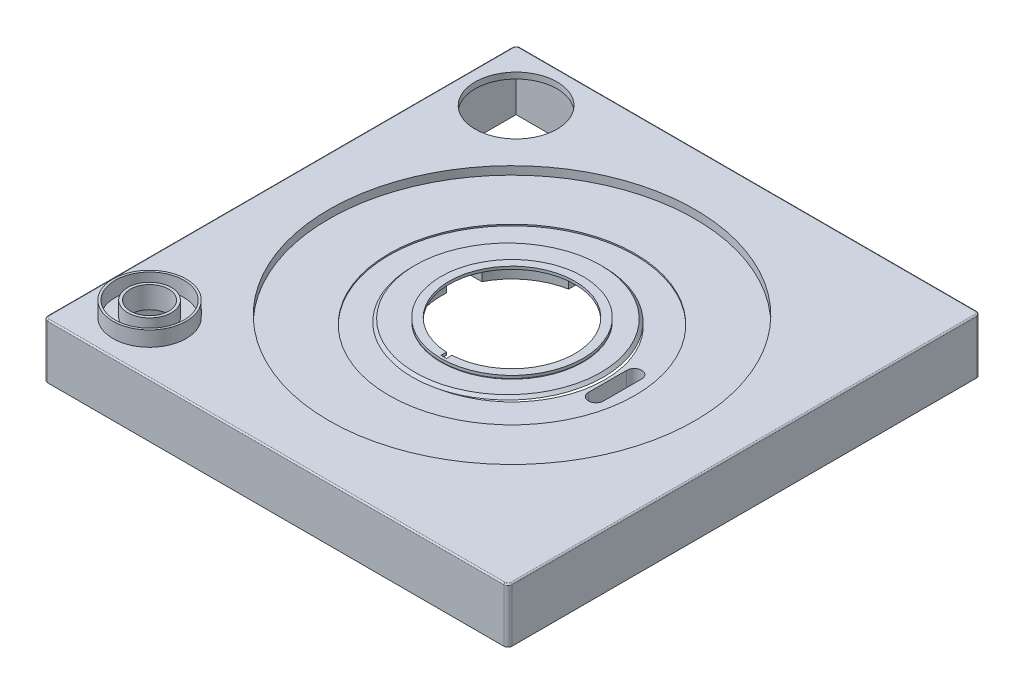
from build123d import *
from build123d.topology import SkipClean

# Parameters (mm, degrees)
EXTRUDE_1_DEPTH          = 20
SKETCH_4_R               = 67
CUT_EXTRUDE_2_DEPTH      = 3
SHELL_9_T                = -2.2
SKETCH_9_R               = 45
CUT_EXTRUDE_3_DEPTH      = 0.5
SKETCH_11_R              = 26
SKETCH_11_R_2            = 23
EXTRUDE_2_DEPTH          = 1.2
SKETCH_14_R              = 23
CUT_EXTRUDE_4_DEPTH      = 5
SKETCH_15_R              = 34
CUT_EXTRUDE_5_DEPTH      = 2
SKETCH_16_R              = 26
CUT_EXTRUDE_9_DEPTH      = 1.2
EXTRUDE_4_DEPTH          = 4
CUT_EXTRUDE_10_DEPTH     = 3
CUT_EXTRUDE_START        = 17.8
CUT_EXTRUDE_11_OUTLINE_R = 15
CUT_EXTRUDE_11_DEPTH     = 2.2
SKETCH_25_R              = 17.002315459
SKETCH_25_R_2            = 15.503974497
CUT_EXTRUDE_12_DEPTH     = 0.5
SKETCH_26_R              = 13.4
SKETCH_26_R_2            = 12.6
EXTRUDE_5_DEPTH          = 5.5
EXTRUDE_6_DEPTH          = 5.5
EXTRUDE_6_DEPTH_BACK     = 2.5
SKETCH_27_R              = 8
SKETCH_27_R_2            = 7
SKETCH_28_R              = 7
CUT_EXTRUDE_13_DEPTH     = 3
FILLET_1_R               = 0.5
CUT_EXTRUDE_14_DEPTH     = 3
EXTRUDE_7_DEPTH          = 16.8


# Read off the part's stored shape, not the designer's step: 切除-拉伸11
with BuildPart() as part:
    # 草图2 → 凸台-拉伸1 (new body)
    with BuildSketch(Plane(origin=(0, 0, 0), x_dir=(1, 0, 0), z_dir=(0, 1, 0))):
        with BuildLine():
            Line((-83.5, 86.5), (83.5, 86.5))
            ThreePointArc((83.5, 86.5), (84.560660172, 86.060660172), (85, 85))
            Line((85, 85), (85, -85))
            ThreePointArc((85, -85), (84.560660172, -86.060660172), (83.5, -86.5))
            Line((83.5, -86.5), (-83.5, -86.5))
            ThreePointArc((-83.5, -86.5), (-84.560660172, -86.060660172), (-85, -85))
            Line((-85, -85), (-85, 85))
            ThreePointArc((-85, 85), (-84.560660172, 86.060660172), (-83.5, 86.5))
        make_face()
    extrude(amount=EXTRUDE_1_DEPTH)

    # 草图4 → 切除-拉伸2 (cut)
    with BuildSketch(Plane(origin=(0, 20, 0), x_dir=(1, 0, 0), z_dir=(0, 1, 0))):
        with Locations(Location((0, 0, 0), (0, 0, 270))):
            Circle(SKETCH_4_R)
    extrude(amount=-CUT_EXTRUDE_2_DEPTH, mode=Mode.SUBTRACT)

    # 抽壳9
    shell_9_openings = [part.faces().sort_by_distance(p)[0] for p in [
        (0, 0, 0),
    ]]
    offset(amount=SHELL_9_T, openings=shell_9_openings, kind=Kind.INTERSECTION)

    # 草图9 → 切除-拉伸3 (cut)
    with BuildSketch(Plane(origin=(0, 17, 0), x_dir=(1, 0, 0), z_dir=(0, 1, 0))):
        with Locations(Location((0, 0, 0), (0, 0, 270))):
            Circle(SKETCH_9_R)
    extrude(amount=-CUT_EXTRUDE_3_DEPTH, mode=Mode.SUBTRACT)


with BuildPart() as body_2:
    # 草图10 → 旋转1 (revolve)
    with BuildSketch(Plane.XY, mode=Mode.PRIVATE) as revolve_1_sk:
        Polygon((-1.499800563, 17.05484119), (-36.499800563, 17.05484119), (-35.499800563, 18.05484119), (-1.499800563, 18.05484119), align=None)
    revolve(revolve_1_sk.sketch.rotate(Axis((-1.499800563, 17.05484119, 0), (0, 1, 0)), 270), axis=Axis((-1.499800563, 17.05484119, 0), (0, 1, 0)))

    # 草图11 → 凸台-拉伸2 (add)
    with BuildSketch(Plane(origin=(0, 18.05484119, 0), x_dir=(1, 0, 0), z_dir=(0, 1, 0))):
        with Locations(Location((0, 0, 0), (0, 0, 90))):
            Circle(SKETCH_11_R)
        with Locations(Location((0, 0, 0), (0, 0, 270))):
            Circle(SKETCH_11_R_2, mode=Mode.SUBTRACT)
    extrude(amount=EXTRUDE_2_DEPTH)


with BuildPart() as cut_extrude_4_tool:
    # 草图14 → 切除-拉伸4 (new body)
    with BuildSketch(Plane(origin=(0, 18.05484119, 0), x_dir=(1, 0, 0), z_dir=(0, 1, 0))):
        with Locations(Location((0, 0, 0), (0, 0, 270))):
            Circle(SKETCH_14_R)
    extrude(amount=-CUT_EXTRUDE_4_DEPTH)


with BuildPart() as part_1:
    add(part.part)

    # 切除-拉伸4: cut by cut_extrude_4_tool
    add(cut_extrude_4_tool.part, mode=Mode.SUBTRACT)

    # 草图15 → 切除-拉伸5 (cut)
    with BuildSketch(Plane.XZ.offset(-14.8)):
        with Locations(Location((0, 0, 0), (0, 0, 270))):
            Circle(SKETCH_15_R)
    extrude(amount=-CUT_EXTRUDE_5_DEPTH, mode=Mode.SUBTRACT)

    # 切除-拉伸11 outline → 切除-拉伸11 (cut)
    with BuildSketch(Plane(origin=(0, 0, 0), x_dir=(1, 0, 0), z_dir=(0, 1, 0)).offset(CUT_EXTRUDE_START)):
        with Locations((-65.7, 67.2)):
            Circle(CUT_EXTRUDE_11_OUTLINE_R)
    extrude(amount=CUT_EXTRUDE_11_DEPTH, mode=Mode.SUBTRACT)

    # 草图25 → 切除-拉伸12 (cut)
    with BuildSketch(Plane.XZ.offset(-17.8)):
        with Locations(Location((-65.7438908, -67.2, 0), (0, 0, 270))):
            Circle(SKETCH_25_R)
        with Locations(Location((-65.7438908, -67.2, 0), (0, 0, 270))):
            Circle(SKETCH_25_R_2, mode=Mode.SUBTRACT)
    extrude(amount=-CUT_EXTRUDE_12_DEPTH, mode=Mode.SUBTRACT)

    # 草图26 → 凸台-拉伸5 (add)
    with BuildSketch(Plane(origin=(0, 20, 0), x_dir=(1, 0, 0), z_dir=(0, 1, 0))):
        with Locations(Location((-65.6, -67.1, 0), (0, 0, 90))):
            Circle(SKETCH_26_R)
        with Locations(Location((-65.6, -67.1, 0), (0, 0, 270))):
            Circle(SKETCH_26_R_2, mode=Mode.SUBTRACT)
    extrude(amount=EXTRUDE_5_DEPTH)

    # 草图27 → 凸台-拉伸6 (add, two sides: drawn at the far end of the back side and taken through both)
    with BuildSketch(Plane(origin=(0, 20, 0), x_dir=(1, 0, 0), z_dir=(0, 1, 0)).offset(-EXTRUDE_6_DEPTH_BACK)):
        with Locations(Location((-65.6, -67.1, 0), (0, 0, 90))):
            Circle(SKETCH_27_R)
        with Locations(Location((-65.6, -67.1, 0), (0, 0, 90))):
            Circle(SKETCH_27_R_2, mode=Mode.SUBTRACT)
    extrude(amount=EXTRUDE_6_DEPTH + EXTRUDE_6_DEPTH_BACK)

    # 草图28 → 切除-拉伸13 (cut)
    with SkipClean():  # the faces are left unmerged after this step: merging them gives an invalid solid
        with BuildSketch(Plane(origin=(0, 20, 0), x_dir=(1, 0, 0), z_dir=(0, 1, 0))):
            with Locations(Location((-65.6, -67.1, 0), (0, 0, 270))):
                Circle(SKETCH_28_R)
        extrude(amount=-CUT_EXTRUDE_13_DEPTH, mode=Mode.SUBTRACT)
    add(part_1.part.scale(1), mode=Mode.REPLACE)  # the faces are merged on a copy

    # 圆角1
    fillet_1_edges = [part_1.edges().sort_by_distance(p)[0] for p in [
        (84.560660172, 20, 86.060660172),
        (85, 20, 0),
        (84.560660172, 20, -86.060660172),
        (0, 20, -86.5),
        (-84.560660172, 20, -86.060660172),
        (-85, 20, 0),
        (-84.560660172, 20, 86.060660172),
        (0, 20, 86.5),
    ]]
    fillet(fillet_1_edges, radius=FILLET_1_R)

    # 草图30 → 切除-拉伸14 (cut)
    with BuildSketch(Plane(origin=(0, 16.5, 0), x_dir=(1, 0, 0), z_dir=(0, 1, 0))):
        with BuildLine():
            Line((35, -7), (35, 7))
            ThreePointArc((35, 7), (37.75, 9.75), (40.5, 7))
            Line((40.5, 7), (40.5, -7))
            ThreePointArc((40.5, -7), (37.75, -9.75), (35, -7))
        make_face()
    extrude(amount=-CUT_EXTRUDE_14_DEPTH, mode=Mode.SUBTRACT)

    # 草图31 → 凸台-拉伸7 (add)
    with SkipClean():  # the faces are left unmerged after this step: merging them gives an invalid solid
        with BuildSketch(Plane.XZ.offset(-14.8)):
            with BuildLine():
                Line((41.5, 7), (41.5, -7))
                ThreePointArc((41.5, -7), (37.75, -10.75), (34, -7))
                Line((34, -7), (34, 7))
                ThreePointArc((34, 7), (37.75, 10.75), (41.5, 7))
            make_face()
            with BuildLine():
                Line((40.5, 7), (40.5, -7))
                ThreePointArc((40.5, -7), (37.75, -9.75), (35, -7))
                Line((35, -7), (35, 7))
                ThreePointArc((35, 7), (37.75, 9.75), (40.5, 7))
            make_face(mode=Mode.SUBTRACT)
        extrude(amount=EXTRUDE_7_DEPTH)


with BuildPart() as body_2_1:
    add(body_2.part)

    # 切除-拉伸4: cut by cut_extrude_4_tool
    add(cut_extrude_4_tool.part, mode=Mode.SUBTRACT)

    # 草图16 → 切除-拉伸9 (cut)
    with BuildSketch(Plane.XZ.offset(-17.05484119)):
        with Locations(Location((0, 0, 0), (0, 0, 270))):
            Circle(SKETCH_16_R)
    extrude(amount=-CUT_EXTRUDE_9_DEPTH, mode=Mode.SUBTRACT)


with BuildPart() as cut_extrude_9_piece_1:
    # of the separate pieces the step leaves, piece 1, a body of its own (cut_extrude_9_pieces)
    add(body_2_1.part.solids().sort_by_distance((-1.499800563, 17.05484119, -35))[0])

    # 草图21 → 凸台-拉伸4 (add)
    with BuildSketch(Plane.XZ.offset(-17.05484119)):
        with BuildLine():
            Line((-6.8, -27.161737794), (-6.8, -32.88212568))
            ThreePointArc((-6.8, -32.88212568), (-5.802653118, -33.072698802), (-4.8, -33.23302859))
            Line((-4.8, -33.23302859), (-4.8, -25.553082006))
            ThreePointArc((-4.8, -25.553082006), (-15.493153598, -20.879707651), (-23.065125189, -12))
            Line((-23.065125189, -12), (-31.360392046, -12))
            ThreePointArc((-31.360392046, -12), (-30.956383036, -13.006788174), (-30.520062078, -14))
            Line((-30.520062078, -14), (-24.248711306, -14))
            ThreePointArc((-24.248711306, -14), (-16.861597015, -22.353669634), (-6.8, -27.161737794))
        make_face()
        with BuildLine():
            Line((16.2, -20.336174665), (16.2, -29.411463569))
            ThreePointArc((16.2, -29.411463569), (17.210354861, -28.831889893), (18.2, -28.217621963))
            Line((18.2, -28.217621963), (18.2, -21.278157815))
            ThreePointArc((18.2, -21.278157815), (27.255382435, 6.414368897), (6.8, 27.161737794))
            Line((6.8, 27.161737794), (6.8, 32.88212568))
            ThreePointArc((6.8, 32.88212568), (5.802653118, 33.072698802), (4.8, 33.23302859))
            Line((4.8, 33.23302859), (4.8, 25.553082006))
            ThreePointArc((4.8, 25.553082006), (25.233033299, 6.268495079), (16.2, -20.336174665))
        make_face()
        with BuildLine():
            Line((-19.099153457, 17.641494756), (-19.2, 17.641494756))
            Line((-19.2, 17.641494756), (-19.2, 27.546945189))
            ThreePointArc((-19.2, 27.546945189), (-20.214064586, 26.811672499), (-21.2, 26.03908964))
            Line((-21.2, 26.03908964), (-21.2, 18.290981384))
            ThreePointArc((-21.2, 18.290981384), (-26.244999524, 9.757048734), (-28, 0))
            Line((-28, 0), (-33.577882442, 0))
            ThreePointArc((-33.577882442, 0), (-33.562975147, -1.000444159), (-33.518266501, -2))
            Line((-33.518266501, -2), (-25.922962794, -2))
            ThreePointArc((-25.922962794, -2), (-24.560024776, 8.532595327), (-19.099153457, 17.641494756))
        make_face()
    extrude(amount=EXTRUDE_4_DEPTH)


with BuildPart() as cut_extrude_9_piece_2:
    # of the separate pieces the step leaves, piece 2, a body of its own (cut_extrude_9_pieces)
    add(body_2_1.part.solids().sort_by_distance((0, 18.25484119, -26))[0])

    # 草图22 → 切除-拉伸10 (cut)
    with BuildSketch(Plane.XZ.offset(-18.25484119)):
        with BuildLine():
            Line((-1, 22.978250586), (-1, 25))
            Line((-1, 25), (1, 25))
            Line((1, 25), (1, 22.978250586))
            ThreePointArc((1, 22.978250586), (0, 23), (-1, 22.978250586))
        make_face()
    extrude(amount=-CUT_EXTRUDE_10_DEPTH, mode=Mode.SUBTRACT)


solid = Compound([part_1.part, cut_extrude_9_piece_1.part, cut_extrude_9_piece_2.part])
